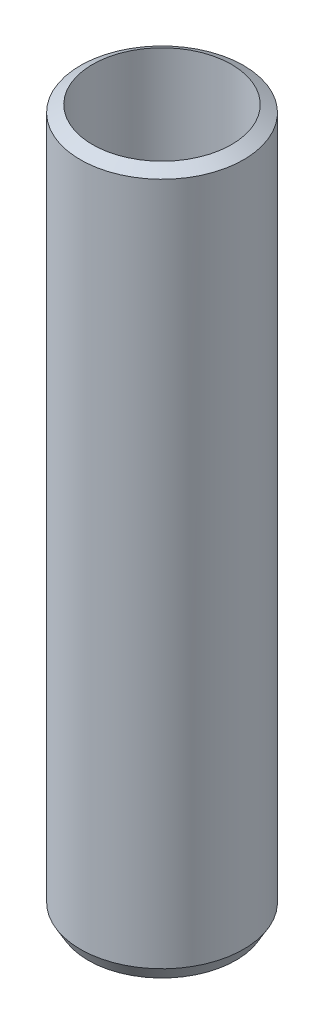
from build123d import *

# Parameters (mm, degrees)
SKETCH1_R           = 60
BOSS_EXTRUDE1_DEPTH = 518.070102
SKETCH2_R           = 51.068545557
CUT_EXTRUDE1_DEPTH  = 525.972980815
CHAMFER1_SIZE       = 5.743657
CHAMFER1_SIZE_2     = 9.948306


with BuildPart() as part:
    # Sketch1 → Boss-Extrude1 (new body)
    with BuildSketch(Plane(origin=(0, 0, 0), x_dir=(1, 0, 0), z_dir=(0, 1, 0))):
        with Locations(Location((0, 0, 0), (0, 0, 270))):
            Circle(SKETCH1_R)
    extrude(amount=BOSS_EXTRUDE1_DEPTH)

    # Sketch2 → Cut-Extrude1 (cut, through all)
    with BuildSketch(Plane(origin=(0, 0, 0), x_dir=(1, 0, 0), z_dir=(0, 1, 0))):
        with Locations(Location((0, 0, 0), (0, 0, 270))):
            Circle(SKETCH2_R)
    extrude(amount=CUT_EXTRUDE1_DEPTH, mode=Mode.SUBTRACT)

    # Chamfer1
    # the kernel refuses this chamfer: 9.948306, 5.743657 mm, written as the material it takes off along each edge
    with BuildSketch(Plane(origin=(0, 518.070102, 0), x_dir=(0, 0, 1), z_dir=(-1, 0, 0))) as chamfer1_piece_1:
        Polygon((60, -CHAMFER1_SIZE), (60 - CHAMFER1_SIZE_2, 0), (60, 0), align=None)
    revolve(axis=Axis((0, 518.070102, 0), (0, 1, 0)), mode=Mode.SUBTRACT)
    with BuildSketch(Plane(origin=(0, 0, 0), x_dir=(0, 0, 1), z_dir=(-1, 0, 0))) as chamfer1_piece_2:
        Polygon((60, CHAMFER1_SIZE_2), (60 - CHAMFER1_SIZE, 0), (60, 0), align=None)
    revolve(axis=Axis((0, 0, 0), (0, 1, 0)), mode=Mode.SUBTRACT)


solid = part.part
